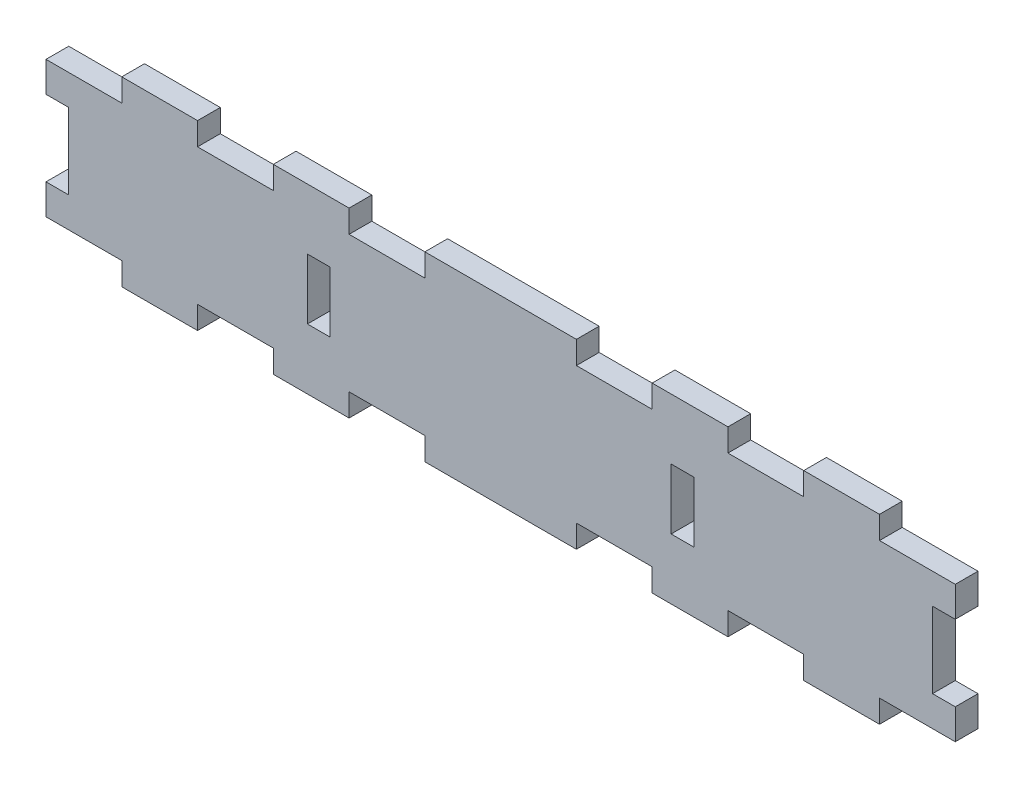
from build123d import *

# Parameters (mm, degrees)
SKETCH1_W               = 120
SKETCH1_H               = 24
BOSS_EXTRUDE1_DEPTH     = 3
SKETCH2_W               = 10
SKETCH2_H               = 3
CUT_EXTRUDE1_DEPTH      = 62.26173357
MIRROR3_COPY_1_SKETCH_W = 10
MIRROR3_COPY_1_SKETCH_H = 3
MIRROR3_COPY_1_DEPTH    = 62.26173357
MIRROR3_COPY_2_SKETCH_W = 10
MIRROR3_COPY_2_SKETCH_H = 3
MIRROR3_COPY_2_DEPTH    = 62.26173357
SKETCH3_W               = 3
SKETCH3_H               = 8
SKETCH3_H_2             = 10
CUT_EXTRUDE2_DEPTH      = 62.26173357


with BuildPart() as part:
    # Sketch1 → Boss-Extrude1 (new body)
    with BuildSketch(Plane.XY):
        Rectangle(SKETCH1_W, SKETCH1_H)
    extrude(amount=BOSS_EXTRUDE1_DEPTH)

    # Sketch2 → Cut-Extrude1 (cut, through all)
    with BuildSketch(Plane.XY.offset(3)):
        with Locations((15, 10.5)):
            Rectangle(SKETCH2_W, SKETCH2_H)
        with Locations((35, 10.5)):
            Rectangle(SKETCH2_W, SKETCH2_H)
        with Locations((55, 10.5)):
            Rectangle(SKETCH2_W, SKETCH2_H)
    cut_extrude1 = extrude(amount=-CUT_EXTRUDE1_DEPTH, mode=Mode.SUBTRACT)

    # Mirror2: Cut-Extrude1 across plane
    add(cut_extrude1.mirror(Plane(origin=(0, 0, 0), x_dir=(0, 0, 1), z_dir=(1, 0, 0))), mode=Mode.SUBTRACT)

    # Mirror3 copy 1 sketch → Mirror3 copy 1 (cut, through all)
    with BuildSketch(Plane(origin=(0, 0, 3), x_dir=(-1, 0, 0), z_dir=(0, 0, 1))):
        with Locations((15, 10.5)):
            Rectangle(MIRROR3_COPY_1_SKETCH_W, MIRROR3_COPY_1_SKETCH_H)
        with Locations((35, 10.5)):
            Rectangle(MIRROR3_COPY_1_SKETCH_W, MIRROR3_COPY_1_SKETCH_H)
        with Locations((55, 10.5)):
            Rectangle(MIRROR3_COPY_1_SKETCH_W, MIRROR3_COPY_1_SKETCH_H)
    extrude(amount=-MIRROR3_COPY_1_DEPTH, mode=Mode.SUBTRACT)

    # Mirror3 copy 2 sketch → Mirror3 copy 2 (cut, through all)
    with BuildSketch(Plane.XY.offset(3)):
        with Locations((15, -10.5)):
            Rectangle(MIRROR3_COPY_2_SKETCH_W, MIRROR3_COPY_2_SKETCH_H)
        with Locations((35, -10.5)):
            Rectangle(MIRROR3_COPY_2_SKETCH_W, MIRROR3_COPY_2_SKETCH_H)
        with Locations((55, -10.5)):
            Rectangle(MIRROR3_COPY_2_SKETCH_W, MIRROR3_COPY_2_SKETCH_H)
    extrude(amount=-MIRROR3_COPY_2_DEPTH, mode=Mode.SUBTRACT)

    # Sketch3 → Cut-Extrude2 (cut, through all)
    with BuildSketch(Plane.XY.offset(3)):
        with Locations((24, 0)):
            Rectangle(SKETCH3_W, SKETCH3_H)
        with Locations((-24, 0)):
            Rectangle(SKETCH3_W, SKETCH3_H)
        with Locations((58.5, 0)):
            Rectangle(SKETCH3_W, SKETCH3_H_2)
        with Locations((-58.5, 0)):
            Rectangle(SKETCH3_W, SKETCH3_H_2)
    extrude(amount=-CUT_EXTRUDE2_DEPTH, mode=Mode.SUBTRACT)


solid = part.part
